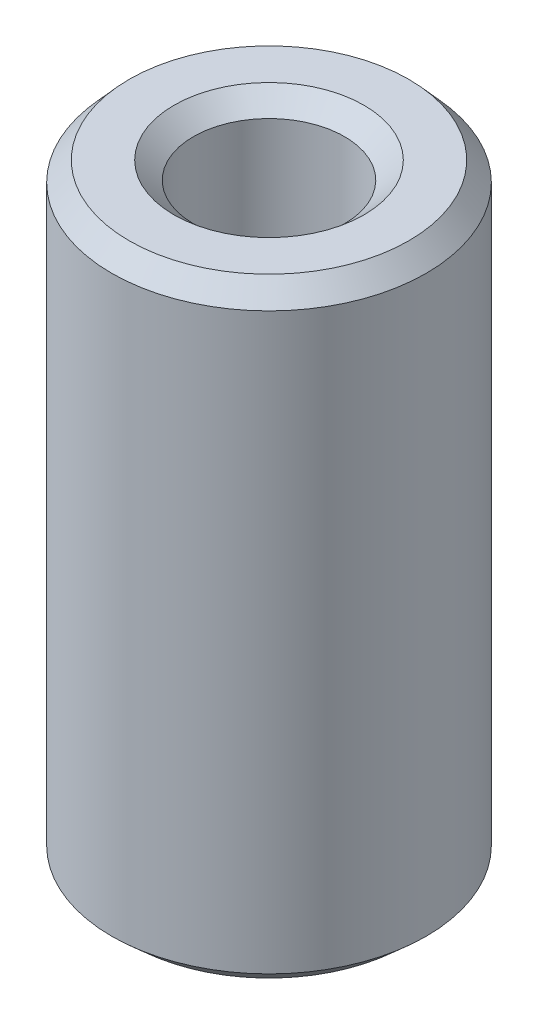
from build123d import *
from OCP.BRepFilletAPI import BRepFilletAPI_MakeChamfer

# Parameters (mm, degrees)
SKETCH1_R           = 15
BOSS_EXTRUDE1_DEPTH = 58.292685388
SKETCH2_R           = 7.204365807
CUT_EXTRUDE1_DEPTH  = 63.032549276
CHAMFER1_SIZE       = 1.858217743
CHAMFER1_SIZE2      = 1.660687062


with BuildPart() as part:
    # Sketch1 → Boss-Extrude1 (new body)
    with BuildSketch(Plane(origin=(0, 0, 0), x_dir=(1, 0, 0), z_dir=(0, 1, 0))):
        Circle(SKETCH1_R)
    extrude(amount=BOSS_EXTRUDE1_DEPTH)

    # Sketch2 → Cut-Extrude1 (cut, through all)
    with BuildSketch(Plane(origin=(0, 0, 0), x_dir=(1, 0, 0), z_dir=(0, 1, 0))):
        Circle(SKETCH2_R)
    extrude(amount=CUT_EXTRUDE1_DEPTH, mode=Mode.SUBTRACT)

    # Chamfer1: one chamfer whose edges measure the first distance from different faces: ONE call of the kernel's chamfer builder (chamfer() names one face for all edges)
    chamfer1_edges_1 = [part.edges().sort_by_distance(p)[0] for p in [
        (-7.204365807, 58.292685388, 0),
    ]]
    chamfer1_side_1 = [part.faces().sort_by_distance(p)[0] for p in [
        (-14.575735931, 58.292685388, 0),
    ]]
    chamfer1_edges_2 = [part.edges().sort_by_distance(p)[0] for p in [
        (-7.204365807, 0, 0),
    ]]
    chamfer1_side_2 = [part.faces().sort_by_distance(p)[0] for p in [
        (-7.204365807, 29.146342694, 0),
    ]]
    chamfer1_edges_3 = [part.edges().sort_by_distance(p)[0] for p in [
        (-15, 0, 0),
    ]]
    chamfer1_side_3 = [part.faces().sort_by_distance(p)[0] for p in [
        (-14.575735931, 0, 0),
    ]]
    chamfer1_edges_4 = [part.edges().sort_by_distance(p)[0] for p in [
        (-15, 58.292685388, 0),
    ]]
    chamfer1_side_4 = [part.faces().sort_by_distance(p)[0] for p in [
        (-15, 29.146342694, 0),
    ]]
    chamfer1 = BRepFilletAPI_MakeChamfer(part.part.solid().wrapped)
    for e in chamfer1_edges_1:
        chamfer1.Add(CHAMFER1_SIZE, CHAMFER1_SIZE2, e.wrapped, chamfer1_side_1[0].wrapped)  # the first distance lies on this face
    for e in chamfer1_edges_2:
        chamfer1.Add(CHAMFER1_SIZE, CHAMFER1_SIZE2, e.wrapped, chamfer1_side_2[0].wrapped)  # the first distance lies on this face
    for e in chamfer1_edges_3:
        chamfer1.Add(CHAMFER1_SIZE, CHAMFER1_SIZE2, e.wrapped, chamfer1_side_3[0].wrapped)  # the first distance lies on this face
    for e in chamfer1_edges_4:
        chamfer1.Add(CHAMFER1_SIZE, CHAMFER1_SIZE2, e.wrapped, chamfer1_side_4[0].wrapped)  # the first distance lies on this face
    add(Compound.cast(chamfer1.Shape()), mode=Mode.REPLACE)


solid = part.part
